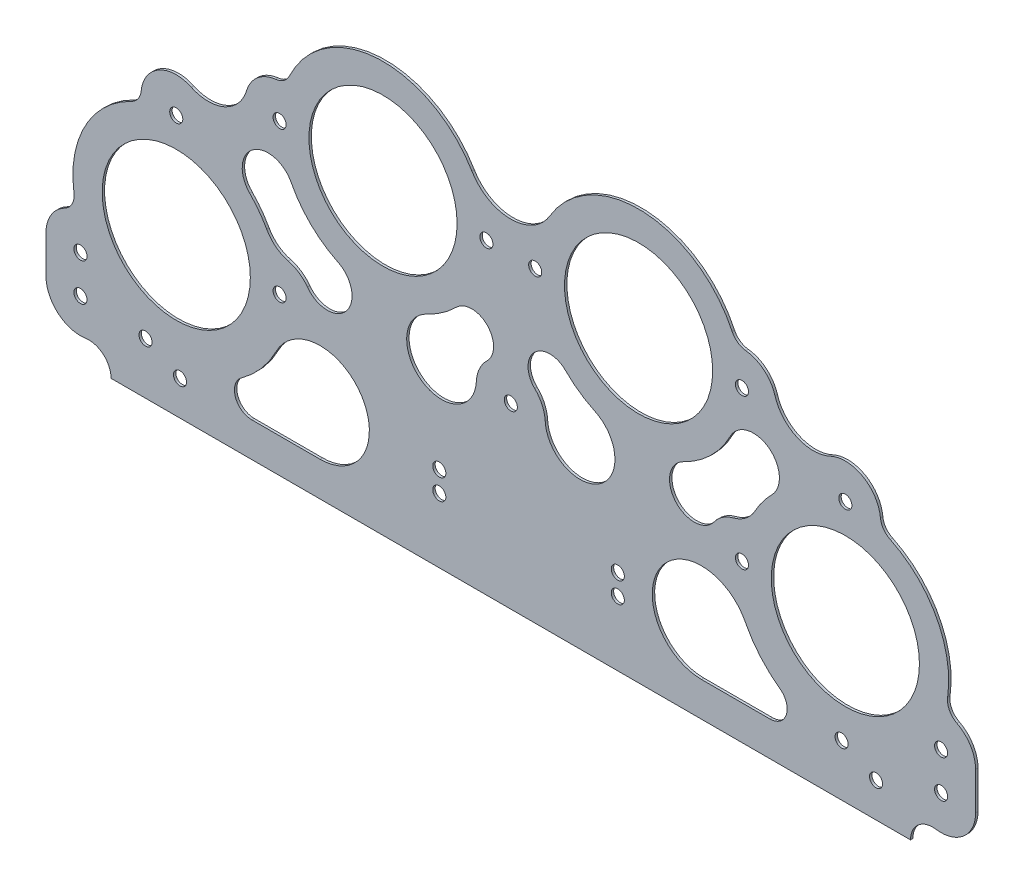
from build123d import *

# Parameters (mm, degrees)
MODEL_R            = 21.5
MODEL_R_2          = 1.89865
BASE_FLANGE1_DEPTH = 0.7


# Sheet-metal steps are written as plain solids
with BuildPart() as part:
    # Model → Base-Flange1 (new body)
    with BuildSketch(Plane.XY):
        with BuildLine():
            Line((-134.72553251, -2.711313899), (-134.72553251, 8.193532943))
            ThreePointArc((-134.72553251, 8.193532943), (-133.25770932, 13.409082664), (-129.285140732, 17.093531418))
            ThreePointArc((-129.285140732, 17.093531418), (-127.122461212, 19.249115875), (-126.616601885, 22.260400219))
            ThreePointArc((-126.616601885, 22.260400219), (-123.404934832, 40.6646253), (-109.924644657, 53.599542498))
            ThreePointArc((-109.924644657, 53.599542498), (-107.998724055, 55.233004005), (-107.116719879, 57.599316598))
            ThreePointArc((-107.116719879, 57.599316598), (-101.974015213, 65.474503584), (-92.575264278, 65.83431216))
            ThreePointArc((-92.575264278, 65.83431216), (-82.894170466, 65.746450056), (-76.506575672, 73.021745919))
            ThreePointArc((-76.506575672, 73.021745919), (-73.335376859, 77.830552746), (-68.037655249, 80.092249178))
            ThreePointArc((-68.037655249, 80.092249178), (-65.683638934, 80.995038824), (-64.06940128, 82.931700578))
            ThreePointArc((-64.06940128, 82.931700578), (-38.361840541, 100.119815012), (-11.129181755, 85.467434576))
            ThreePointArc((-11.129181755, 85.467434576), (0.155495187, 79.042938382), (11.440172129, 85.467434576))
            ThreePointArc((11.440172129, 85.467434576), (38.672830915, 100.119815012), (64.380391655, 82.931700578))
            ThreePointArc((64.380391655, 82.931700578), (65.994629309, 80.995038824), (68.348645623, 80.092249178))
            ThreePointArc((68.348645623, 80.092249178), (73.646367234, 77.830552746), (76.817566047, 73.021745919))
            ThreePointArc((76.817566047, 73.021745919), (83.205160841, 65.746450057), (92.886254653, 65.83431216))
            ThreePointArc((92.886254653, 65.83431216), (102.285005587, 65.474503584), (107.427710253, 57.599316599))
            ThreePointArc((107.427710253, 57.599316599), (108.309714429, 55.233004005), (110.235635031, 53.599542498))
            ThreePointArc((110.235635031, 53.599542498), (123.715925206, 40.6646253), (126.92759226, 22.260400219))
            ThreePointArc((126.92759226, 22.260400219), (127.433451587, 19.249115875), (129.596131107, 17.093531418))
            ThreePointArc((129.596131107, 17.093531418), (133.568699694, 13.409082664), (135.036522885, 8.193532943))
            Line((135.036522885, 8.193532943), (135.036522885, -2.711313899))
            ThreePointArc((135.036522885, -2.711313899), (131.562361662, -10.288478821), (123.553837233, -12.600785232))
            ThreePointArc((123.553837233, -12.600785232), (118.393911689, -14.090613855), (116.155495187, -18.972612677))
            Line((116.155495187, -18.972612677), (-115.844504813, -18.972612677))
            ThreePointArc((-115.844504813, -18.972612677), (-118.082921315, -14.090613855), (-123.242846859, -12.600785232))
            ThreePointArc((-123.242846859, -12.600785232), (-131.251371287, -10.288478821), (-134.72553251, -2.711313899))
        make_face()
        with Locations((97.237534512, 26.561617598)):
            Circle(MODEL_R, mode=Mode.SUBTRACT)
        with Locations((37.237534512, 70.154169278)):
            Circle(MODEL_R, mode=Mode.SUBTRACT)
        with Locations((-36.926544138, 70.154169278)):
            Circle(MODEL_R, mode=Mode.SUBTRACT)
        with Locations((-96.926544138, 26.561617598)):
            Circle(MODEL_R, mode=Mode.SUBTRACT)
        with Locations((-66.926544138, 26.561617598)):
            Circle(MODEL_R_2, mode=Mode.SUBTRACT)
        with Locations((-96.926544138, 56.561617598)):
            Circle(MODEL_R_2, mode=Mode.SUBTRACT)
        with Locations((-66.926544138, 70.154169278)):
            Circle(MODEL_R_2, mode=Mode.SUBTRACT)
        with Locations((-6.926544138, 70.154169278)):
            Circle(MODEL_R_2, mode=Mode.SUBTRACT)
        with Locations((7.237534512, 70.154169278)):
            Circle(MODEL_R_2, mode=Mode.SUBTRACT)
        with Locations((67.237534512, 70.154169278)):
            Circle(MODEL_R_2, mode=Mode.SUBTRACT)
        with Locations((67.237534512, 26.561617598)):
            Circle(MODEL_R_2, mode=Mode.SUBTRACT)
        with Locations((97.237534512, 56.561617598)):
            Circle(MODEL_R_2, mode=Mode.SUBTRACT)
        with Locations((31.205495187, 5.741109522)):
            Circle(MODEL_R_2, mode=Mode.SUBTRACT)
        with Locations((31.205495187, -0.258890478)):
            Circle(MODEL_R_2, mode=Mode.SUBTRACT)
        with Locations((-20.594504813, 5.741109522)):
            Circle(MODEL_R_2, mode=Mode.SUBTRACT)
        with Locations((-20.594504813, -0.258890478)):
            Circle(MODEL_R_2, mode=Mode.SUBTRACT)
        with Locations((106.155495187, -8.972612677)):
            Circle(MODEL_R_2, mode=Mode.SUBTRACT)
        with Locations((96.155495187, -3.972612677)):
            Circle(MODEL_R_2, mode=Mode.SUBTRACT)
        with Locations((-95.844504813, -8.972612677)):
            Circle(MODEL_R_2, mode=Mode.SUBTRACT)
        with Locations((-105.844504813, -3.972612677)):
            Circle(MODEL_R_2, mode=Mode.SUBTRACT)
        with Locations((0.155495187, 32.741109522)):
            Circle(MODEL_R_2, mode=Mode.SUBTRACT)
        with Locations((125.036522885, 8.193532943)):
            Circle(MODEL_R_2, mode=Mode.SUBTRACT)
        with Locations((125.036522885, -2.711313899)):
            Circle(MODEL_R_2, mode=Mode.SUBTRACT)
        with Locations((-124.72553251, 8.193532943)):
            Circle(MODEL_R_2, mode=Mode.SUBTRACT)
        with Locations((-124.72553251, -2.711313899)):
            Circle(MODEL_R_2, mode=Mode.SUBTRACT)
        with BuildLine():
            Line((-55.174396268, -8.972612677), (-75.044791575, -8.972612677))
            ThreePointArc((-75.044791575, -8.972612677), (-79.805084567, -5.502191259), (-77.957288455, 0.091543068))
            ThreePointArc((-77.957288455, 0.091543068), (-72.228077848, 5.337026443), (-67.904131763, 11.790121847))
            ThreePointArc((-67.904131763, 11.790121847), (-42.997191019, 12.776991486), (-55.174396268, -8.972612677))
        make_face(mode=Mode.SUBTRACT)
        with BuildLine():
            Line((75.35578195, -8.972612677), (55.485386642, -8.972612677))
            ThreePointArc((55.485386642, -8.972612677), (43.308181393, 12.776991486), (68.215122138, 11.790121847))
            ThreePointArc((68.215122138, 11.790121847), (72.539068222, 5.337026444), (78.26827883, 0.091543068))
            ThreePointArc((78.26827883, 0.091543068), (80.116074941, -5.502191258), (75.35578195, -8.972612677))
        make_face(mode=Mode.SUBTRACT)
        with BuildLine():
            ThreePointArc((-70.676544138, 41.085305146), (-72.916715678, 44.548505526), (-75.610729677, 47.671711247))
            ThreePointArc((-75.610729677, 47.671711247), (-74.68821375, 59.040915165), (-63.59038518, 56.405002726))
            ThreePointArc((-63.59038518, 56.405002726), (-57.854979641, 48.659970354), (-49.959750183, 43.133148939))
            ThreePointArc((-49.959750183, 43.133148939), (-47.569458742, 32.101093782), (-58.851767466, 32.46059901))
            ThreePointArc((-58.851767466, 32.46059901), (-61.310927531, 34.835966522), (-64.426544138, 36.244075963))
            ThreePointArc((-64.426544138, 36.244075963), (-68.050268495, 38.020840178), (-70.676544138, 41.085305146))
        make_face(mode=Mode.SUBTRACT)
        with BuildLine():
            ThreePointArc((-6.784417864, 39.940943329), (-6.664317076, 48.950582141), (-15.674709396, 48.979667628))
            ThreePointArc((-15.674709396, 48.979667628), (-19.687101522, 45.602150659), (-24.226386782, 42.975022802))
            ThreePointArc((-24.226386782, 42.975022802), (-25.600244312, 25.408712194), (-9.830574629, 33.268754878))
            ThreePointArc((-9.830574629, 33.268754878), (-8.941303628, 36.894210931), (-6.784417864, 39.940943329))
        make_face(mode=Mode.SUBTRACT)
        with BuildLine():
            ThreePointArc((10.141565004, 33.268754878), (25.911234687, 25.408712194), (24.537377157, 42.975022802))
            ThreePointArc((24.537377157, 42.975022802), (19.998091896, 45.602150659), (15.98569977, 48.979667628))
            ThreePointArc((15.98569977, 48.979667628), (6.975307449, 48.950582143), (7.095408238, 39.940943329))
            ThreePointArc((7.095408238, 39.940943329), (9.252294003, 36.894210931), (10.141565004, 33.268754878))
        make_face(mode=Mode.SUBTRACT)
        with BuildLine():
            ThreePointArc((64.737534512, 36.244075963), (68.361258869, 38.020840178), (70.987534512, 41.085305146))
            ThreePointArc((70.987534512, 41.085305146), (73.227706053, 44.548505526), (75.921720052, 47.671711247))
            ThreePointArc((75.921720052, 47.671711247), (74.999204125, 59.040915165), (63.901375554, 56.405002726))
            ThreePointArc((63.901375554, 56.405002726), (58.165970015, 48.659970354), (50.270740558, 43.133148939))
            ThreePointArc((50.270740558, 43.133148939), (47.880449116, 32.101093782), (59.16275784, 32.46059901))
            ThreePointArc((59.16275784, 32.46059901), (61.621917905, 34.835966522), (64.737534512, 36.244075963))
        make_face(mode=Mode.SUBTRACT)
    extrude(amount=-BASE_FLANGE1_DEPTH)


solid = part.part
